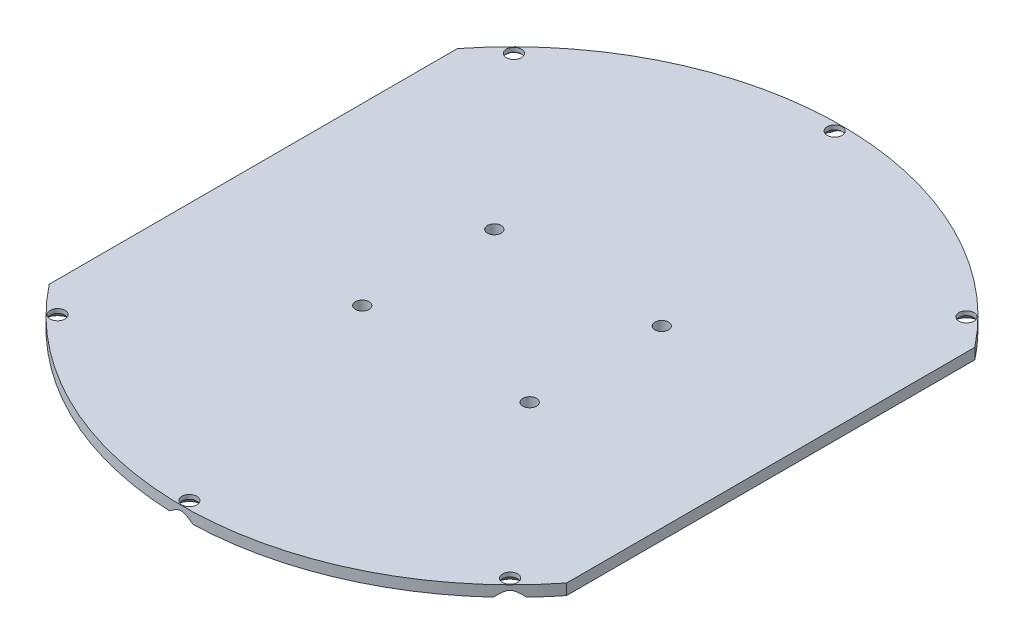
from build123d import *

# Parameters (mm, degrees)
BOTTOM_R                    = 121
BOTTOM_R_2                  = 2.5
BOTTOM_W                    = 10
BOTTOM_H                    = 30
BOTTOM_EXTRUDE_DEPTH        = 4
HOLE_WIZARD_828_D           = 5.5
HOLE_WIZARD_828_DEPTH       = 20
HOLE_WIZARD_828_CSINK_D     = 10.4
HOLE_WIZARD_828_CSINK_ANGLE = 90
HOLE_WIZARD_828_TIP         = 1.652366702
SKETCH6_W                   = 42.362508265
SKETCH6_H                   = 179.383429816
CUT_EXTRUDE1_DEPTH          = 172.166585668


with BuildPart() as part:
    # Bottom → Bottom-Extrude (new body)
    with BuildSketch(Plane(origin=(0, 0, 0), x_dir=(-1, 0, 0), z_dir=(0, 1, 0))):
        Circle(BOTTOM_R)
        with Locations((-30.75, -24.25)):
            Circle(BOTTOM_R_2, mode=Mode.SUBTRACT)
        with Locations((30.75, -24.25)):
            Circle(BOTTOM_R_2, mode=Mode.SUBTRACT)
        with Locations((30.75, 24.25)):
            Circle(BOTTOM_R_2, mode=Mode.SUBTRACT)
        with Locations((-30.75, 24.25)):
            Circle(BOTTOM_R_2, mode=Mode.SUBTRACT)
        with Locations((100, 0)):
            Rectangle(BOTTOM_W, BOTTOM_H, mode=Mode.SUBTRACT)
        with Locations((-100, 0)):
            Rectangle(BOTTOM_W, BOTTOM_H, mode=Mode.SUBTRACT)
    extrude(amount=BOTTOM_EXTRUDE_DEPTH)

    # Hole Wizard 828
    with Locations(Plane(origin=(-38.028259911, 0, 14.277331936), x_dir=(0.9999913982725792, 0, 0.004147695848549348), z_dir=(0, -1, 0))):
        with Locations((-45.469885408, -97.873538962), (-80.031285228, -14.434938782), (-45.469885408, 69.003661398), (37.968714772, 103.565061218), (121.407314952, 69.003661398), (155.968714772, -14.434938782), (121.407314952, -97.873538962), (37.968714772, -132.434938782)):
            CounterSinkHole(HOLE_WIZARD_828_D / 2, HOLE_WIZARD_828_CSINK_D / 2, depth=HOLE_WIZARD_828_DEPTH, counter_sink_angle=HOLE_WIZARD_828_CSINK_ANGLE)
            with Locations((0, 0, -(HOLE_WIZARD_828_DEPTH + HOLE_WIZARD_828_TIP / 2))):  # 118° drill point
                Cone(0, HOLE_WIZARD_828_D / 2, HOLE_WIZARD_828_TIP, mode=Mode.SUBTRACT)

    # Sketch6 → Cut-Extrude1 (cut, through all)
    with BuildSketch(Plane(origin=(0, 0, 0), x_dir=(1, 0, 0), z_dir=(0, 1, 0))):
        with Locations((-116.181254133, -3.884286866)):
            Rectangle(SKETCH6_W, SKETCH6_H)
        with Locations((116.181254133, -3.884286866)):
            Rectangle(SKETCH6_W, SKETCH6_H)
    extrude(amount=CUT_EXTRUDE1_DEPTH, mode=Mode.SUBTRACT)


solid = part.part
